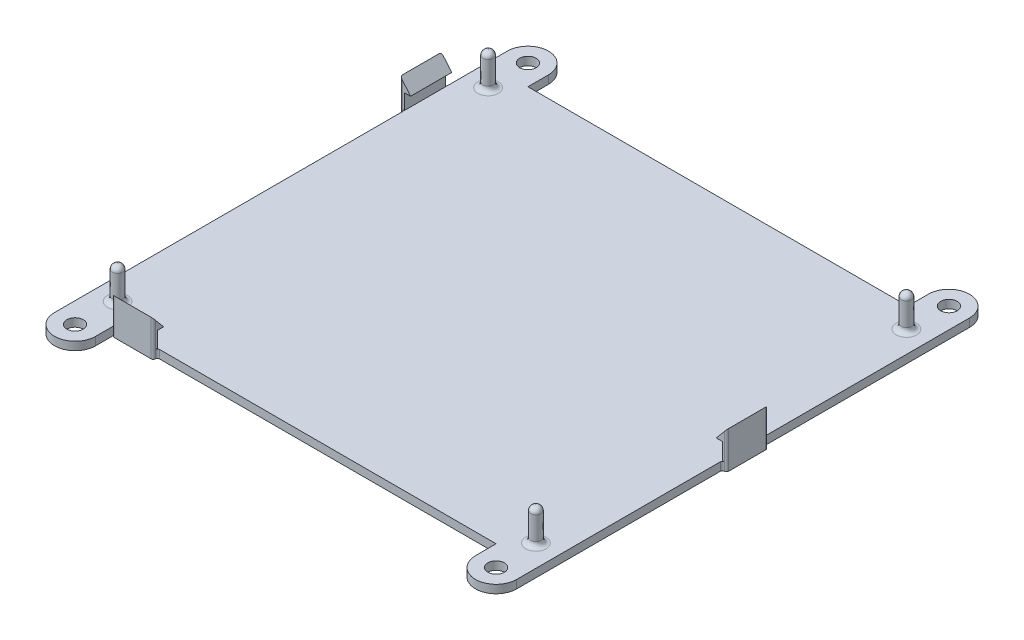
from build123d import *

# Parameters (mm, degrees)
SKETCH2_W           = 112.268
SKETCH2_H           = 100
BOSS_EXTRUDE2_DEPTH = 2
SKETCH1_R           = 1.275
BOSS_EXTRUDE1_DEPTH = 10
BOSS_EXTRUDE3_DEPTH = 5
BOSS_EXTRUDE4_DEPTH = 5
BOSS_EXTRUDE5_DEPTH = 5
FILLET1_R           = 1.2
FILLET2_R           = 0.5
SKETCH6_R           = 2
BOSS_EXTRUDE6_DEPTH = 2


with BuildPart() as part:
    # Sketch2 → Boss-Extrude2 (new body)
    with BuildSketch(Plane(origin=(0, 0, 0), x_dir=(1, 0, 0), z_dir=(0, 1, 0))):
        Rectangle(SKETCH2_W, SKETCH2_H)
    extrude(amount=BOSS_EXTRUDE2_DEPTH)

    # Sketch1 → Boss-Extrude1 (add)
    with BuildSketch(Plane(origin=(0, 0, 0), x_dir=(1, 0, 0), z_dir=(0, 1, 0))):
        with Locations(Location((-50.8, 45, 0), (0, 0, 90))):
            Circle(SKETCH1_R)
        with Locations(Location((50.8, 45, 0), (0, 0, 90))):
            Circle(SKETCH1_R)
        with Locations(Location((50.8, -45, 0), (0, 0, 90))):
            Circle(SKETCH1_R)
        with Locations(Location((-50.8, -45, 0), (0, 0, 90))):
            Circle(SKETCH1_R)
    extrude(amount=BOSS_EXTRUDE1_DEPTH)

    # Sketch3 → Boss-Extrude3 (add, symmetric)
    with BuildSketch(Plane.XY):
        Polygon((57.134, 9), (54.634, 6), (56.134, 6), (56.134, 0), (57.134, 0), align=None)
    extrude(amount=BOSS_EXTRUDE3_DEPTH, both=True)

    # Sketch4 → Boss-Extrude4 (add, symmetric)
    with BuildSketch(Plane.ZY.offset(41.134)):
        Polygon((51, 8.75), (48.5, 5.75), (50, 5.75), (50, 0), (51, 0), align=None)
    extrude(amount=BOSS_EXTRUDE4_DEPTH, both=True)

    # Sketch5 → Boss-Extrude5 (add, symmetric)
    with BuildSketch(Plane(origin=(0, 0, -35), x_dir=(-1, 0, 0), z_dir=(0, 0, -1))):
        Polygon((57.134, 8.75), (54.634, 5.75), (56.134, 5.75), (56.134, 0), (57.134, 0), align=None)
    extrude(amount=BOSS_EXTRUDE5_DEPTH, both=True)

    # Fillet1
    fillet1_edges = [part.edges().sort_by_distance(p)[0] for p in [
        (50.8, 2, -43.725),
        (50.8, 10, -43.725),
        (50.8, 2, 46.275),
        (50.8, 10, 46.275),
        (-50.8, 2, -43.725),
        (-50.8, 10, -43.725),
        (-50.8, 2, 46.275),
        (-50.8, 10, 46.275),
    ]]
    fillet(fillet1_edges, radius=FILLET1_R)

    # Fillet2
    fillet2_edges = [part.edges().sort_by_distance(p)[0] for p in [
        (-56.134, 1, -30),
        (-56.134, 1, -40),
        (56.134, 1, 5),
        (56.134, 1, -5),
        (-46.134, 1, 50),
        (-36.134, 1, 50),
        (-57.134, 4.375, -30),
        (-57.134, 4.375, -40),
        (57.134, 4.5, -5),
        (57.134, 4.5, 5),
        (-36.134, 4.375, 51),
        (-46.134, 4.375, 51),
    ]]
    fillet(fillet2_edges, radius=FILLET2_R - 0.0001)  # a hair under: the kernel refuses the full size

    # Sketch6 → Boss-Extrude6 (add)
    # profile 1 of 4: a face of its own
    with BuildSketch(Plane(origin=(0, 0, 0), x_dir=(1, 0, 0), z_dir=(0, 1, 0))):
        with BuildLine():
            Line((56.134, -50), (46.134, -50))
            Line((46.134, -50), (46.134, -55))
            ThreePointArc((46.134, -55), (51.134, -60), (56.134, -55))
            Line((56.134, -55), (56.134, -50))
        make_face()
        with Locations(Location((51.134, -55, 0), (0, 0, 90))):
            Circle(SKETCH6_R, mode=Mode.SUBTRACT)
    # profile 2 of 4: a face of its own
    with BuildSketch(Plane(origin=(0, 0, 0), x_dir=(1, 0, 0), z_dir=(0, 1, 0))):
        with BuildLine():
            Line((46.134, 50), (46.134, 55))
            ThreePointArc((46.134, 55), (51.134, 60), (56.134, 55))
            Line((56.134, 55), (56.134, 50))
            Line((56.134, 50), (46.134, 50))
        make_face()
        with Locations(Location((51.134, 55, 0), (0, 0, 90))):
            Circle(SKETCH6_R, mode=Mode.SUBTRACT)
    # profile 3 of 4: a face of its own
    with BuildSketch(Plane(origin=(0, 0, 0), x_dir=(1, 0, 0), z_dir=(0, 1, 0))):
        with BuildLine():
            Line((-56.134, 50), (-46.134, 50))
            Line((-46.134, 50), (-46.134, 55))
            ThreePointArc((-46.134, 55), (-51.134, 60), (-56.134, 55))
            Line((-56.134, 55), (-56.134, 50))
        make_face()
        with Locations(Location((-51.134, 55, 0), (0, 0, 90))):
            Circle(SKETCH6_R, mode=Mode.SUBTRACT)
    # profile 4 of 4: a face of its own
    with BuildSketch(Plane(origin=(0, 0, 0), x_dir=(1, 0, 0), z_dir=(0, 1, 0))):
        with BuildLine():
            Line((-46.134, -50), (-46.134, -55))
            ThreePointArc((-46.134, -55), (-51.134, -60), (-56.134, -55))
            Line((-56.134, -55), (-56.134, -50))
            Line((-56.134, -50), (-46.134, -50))
        make_face()
        with Locations(Location((-51.134, -55, 0), (0, 0, 90))):
            Circle(SKETCH6_R, mode=Mode.SUBTRACT)
    extrude(amount=BOSS_EXTRUDE6_DEPTH)


solid = part.part
